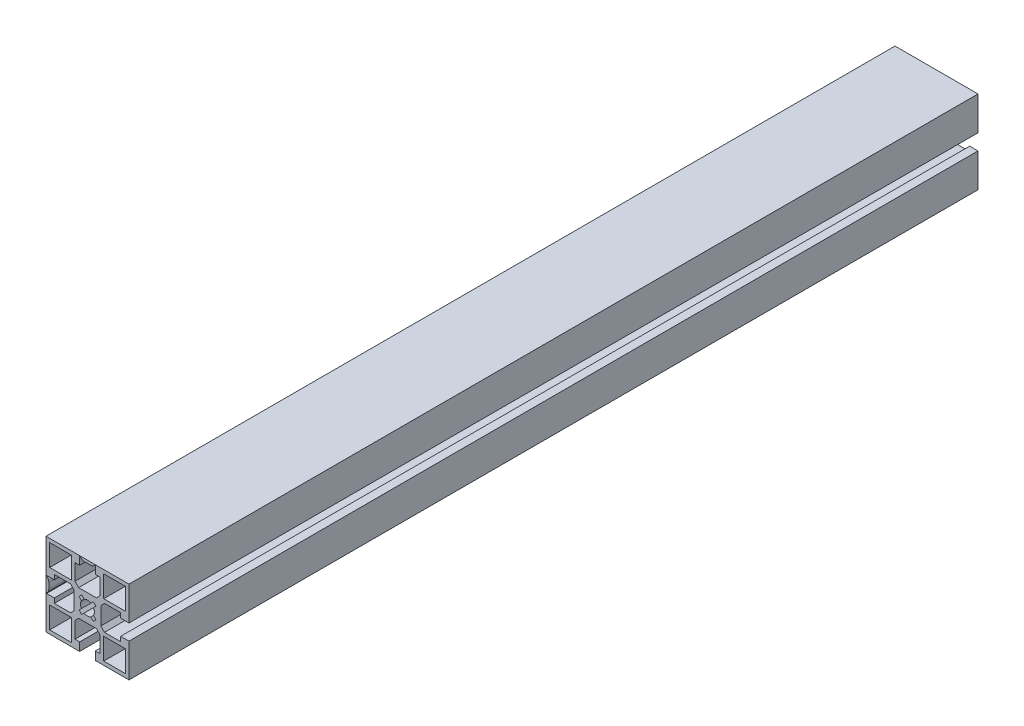
from build123d import *

# Parameters (mm, degrees)
SKETCH1_W           = 11.699975178
SKETCH1_H           = 11.699996949
SKETCH1_W_2         = 11.699990436
SKETCH1_H_2         = 11.699981689
SKETCH1_W_3         = 11.699990437
SKETCH1_H_3         = 11.699975177
SKETCH1_W_4         = 11.699981689
SKETCH1_H_4         = 11.699990436
BOSS_EXTRUDE1_DEPTH = 460.375


with BuildPart() as part:
    # Sketch1 → Boss-Extrude1 (new body)
    with BuildSketch(Plane.XY):
        Polygon((22.500515052, 22.499297556), (-22.499484399, 22.499298105), (-22.499484948, -22.500701346), (-4.249491942, -22.500701568), (-4.249491942, -22.200733242), (-4.24949208, -18.000719999), (-6.799479919, -18.000719999), (-6.799480207, -9.200732353), (-4.799480391, -7.200732362), (4.800525817, -7.200732047), (6.8005258, -9.200731855), (6.800526088, -18.000720263), (4.250507877, -18.000720263), (4.250508015, -22.200733153), (4.250508015, -22.500701672), (22.500514502, -22.500701895), (22.500514725, -4.250714302), (22.200520351, -4.250714302), (18.000507108, -4.25071444), (18.000507108, -6.800702279), (9.200519462, -6.800702567), (7.200519471, -4.800702751), (7.200519156, 4.799303458), (9.200518964, 6.79930344), (18.000507424, 6.799303729), (18.000507424, 4.249285514), (22.200520261, 4.249285652), (22.500514829, 4.249285652), align=None)
        with BuildLine():
            Line((-4.249491247, 17.999291576), (-4.249490956, 22.199304807))
            Line((-4.249490956, 22.199304807), (-3.949472548, 22.199304807))
            Line((-3.949472548, 22.199304807), (-3.481695222, 21.73152644))
            ThreePointArc((-3.481695222, 21.73152644), (-2.670636178, 21.189593132), (-1.713926324, 20.999291428))
            Line((-1.713926324, 20.999291428), (1.714975167, 20.999291428))
            ThreePointArc((1.714975167, 20.999291428), (2.671722509, 21.189608628), (3.482801459, 21.731583767))
            Line((3.482801459, 21.731583767), (3.950490798, 22.199304487))
            Line((3.950490798, 22.199304487), (4.250509108, 22.199304487))
            Line((4.250509108, 22.199304487), (4.250508817, 17.999291575))
            Line((4.250508817, 17.999291575), (6.800527063, 17.999291575))
            Line((6.800527063, 17.999291575), (6.800526453, 9.199302988))
            Line((6.800526453, 9.199302988), (4.800526064, 7.199302969))
            Line((4.800526064, 7.199302969), (-4.799479817, 7.199303635))
            Line((-4.799479817, 7.199303635), (-6.799479854, 9.199304042))
            Line((-6.799479854, 9.199304042), (-6.799479244, 17.999291576))
            Line((-6.799479244, 17.999291576), (-4.249491247, 17.999291576))
        make_face(mode=Mode.SUBTRACT)
        with BuildLine():
            Line((-17.99949762, -4.250714253), (-22.199510799, -4.250714391))
            Line((-22.199510799, -4.250714391), (-22.199510799, -3.950696126))
            Line((-22.199510799, -3.950696126), (-21.731790056, -3.48300681))
            ThreePointArc((-21.731790056, -3.48300681), (-21.189814855, -2.671927844), (-20.999497617, -1.71518046))
            Line((-20.999497617, -1.71518046), (-20.999497617, 1.713721031))
            ThreePointArc((-20.999497617, 1.713721031), (-21.189799286, 2.670430863), (-21.731732544, 3.481489907))
            Line((-21.731732544, 3.481489907), (-22.199510888, 3.949267256))
            Line((-22.199510888, 3.949267256), (-22.199510888, 4.249285566))
            Line((-22.199510888, 4.249285566), (-17.999497356, 4.249285704))
            Line((-17.999497356, 4.249285704), (-17.999497356, 6.79927354))
            Line((-17.999497356, 6.79927354), (-9.199509947, 6.799273828))
            Line((-9.199509947, 6.799273828), (-7.199509956, 4.799274012))
            Line((-7.199509956, 4.799274012), (-7.199509641, -4.800732197))
            Line((-7.199509641, -4.800732197), (-9.199509449, -6.800732179))
            Line((-9.199509449, -6.800732179), (-17.99949762, -6.800732468))
            Line((-17.99949762, -6.800732468), (-17.99949762, -4.250714253))
        make_face(mode=Mode.SUBTRACT)
        with Locations((-14.649542346, -14.650709384)):
            Rectangle(SKETCH1_W, SKETCH1_H, mode=Mode.SUBTRACT)
        with Locations((14.65050626, -14.650767962)):
            Rectangle(SKETCH1_W_2, SKETCH1_H_2, mode=Mode.SUBTRACT)
        with BuildLine():
            Line((-3.181457266, -4.596908447), (-4.595670829, -3.182694885))
            Line((-4.595670829, -3.182694885), (-3.26221457, -1.849238626))
            ThreePointArc((-3.26221457, -1.849238626), (-3.749476751, -0.00071437), (-3.26221457, 1.847809887))
            Line((-3.26221457, 1.847809887), (-4.595670829, 3.181266146))
            Line((-4.595670829, 3.181266146), (-3.181457266, 4.595479708))
            Line((-3.181457266, 4.595479708), (-1.848001007, 3.262023449))
            ThreePointArc((-1.848001007, 3.262023449), (0.000523249, 3.74928563), (1.849047505, 3.262023449))
            Line((1.849047505, 3.262023449), (3.182503764, 4.595479708))
            Line((3.182503764, 4.595479708), (4.596717327, 3.181266146))
            Line((4.596717327, 3.181266146), (3.263261068, 1.847809887))
            ThreePointArc((3.263261068, 1.847809887), (3.750523249, -0.00071437), (3.263261068, -1.849238626))
            Line((3.263261068, -1.849238626), (4.596717327, -3.182694885))
            Line((4.596717327, -3.182694885), (3.182503764, -4.596908447))
            Line((3.182503764, -4.596908447), (1.849047505, -3.263452188))
            ThreePointArc((1.849047505, -3.263452188), (0.000523249, -3.75071437), (-1.848001007, -3.263452188))
            Line((-1.848001007, -3.263452188), (-3.181457266, -4.596908447))
        make_face(mode=Mode.SUBTRACT)
        with Locations((-14.64949028, 14.649335967)):
            Rectangle(SKETCH1_W_3, SKETCH1_H_3, mode=Mode.SUBTRACT)
        with Locations((14.650561583, 14.6492839)):
            Rectangle(SKETCH1_W_4, SKETCH1_H_4, mode=Mode.SUBTRACT)
    extrude(amount=BOSS_EXTRUDE1_DEPTH)


solid = part.part
